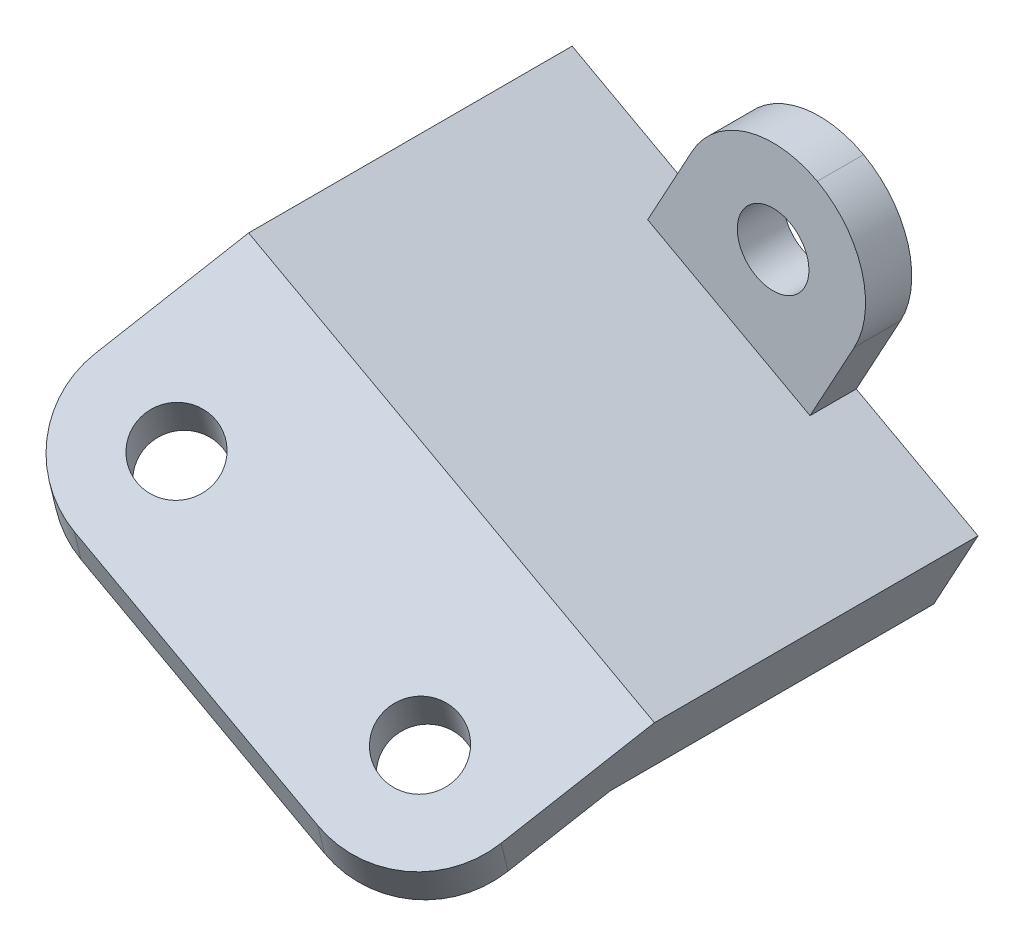
from build123d import *

# Parameters (mm, degrees)
BOSS_EXTRUDE1_DEPTH             = 2
FILLET1_R                       = 4
CUT_EXTRUDE1_REACH              = 137.809
SKETCH2_R                       = 1.55
BOSS_EXTRUDE2_DEPTH             = 12
BOSS_EXTRUDE2_DIRECTION_2_REACH = 137.809
BOSS_EXTRUDE3_DEPTH             = 20
FILLET2_R                       = 4
CUT_EXTRUDE2_REACH              = 70.911
SKETCH5_R                       = 1.55


with BuildPart() as part:
    # Sketch1 → Boss-Extrude1 (new body)
    with BuildSketch(Plane.XY):
        Polygon((70, 114.805547545), (60.427350908, 97.245240333), (53.403228024, 101.07429997), (62.975877115, 118.634607181), align=None)
    extrude(amount=BOSS_EXTRUDE1_DEPTH)

    # Fillet1
    fillet1_edges = [part.edges().sort_by_distance(p)[0] for p in [
        (60.427350908, 97.245240333, 1),
        (53.403228024, 101.07429997, 1),
        (70, 114.805547545, 1),
        (62.975877115, 118.634607181, 1),
    ]]
    fillet(fillet1_edges, radius=FILLET1_R - 0.0001)  # a hair under: the kernel refuses the full size

    # Sketch2 → Cut-Extrude1 (cut, up to next)
    with BuildSketch(Plane.XY.offset(2), mode=Mode.PRIVATE) as cut_extrude1_sk1:
        with Locations((64.573408739, 113.208015921)):
            Circle(SKETCH2_R)
    cut_extrude1_tool1 = extrude(cut_extrude1_sk1.sketch, amount=-CUT_EXTRUDE1_REACH, mode=Mode.PRIVATE) & part.part
    # Sketch2 → Cut-Extrude1 (cut, up to next)
    with BuildSketch(Plane.XY.offset(2), mode=Mode.PRIVATE) as cut_extrude1_sk2:
        with Locations((58.829819284, 102.671831594)):
            Circle(SKETCH2_R)
    cut_extrude1_tool2 = extrude(cut_extrude1_sk2.sketch, amount=-CUT_EXTRUDE1_REACH, mode=Mode.PRIVATE) & part.part
    add(cut_extrude1_tool1.solids().sort_by_distance((64.573409, 113.208016, 2))[0], mode=Mode.SUBTRACT)
    add(cut_extrude1_tool2.solids().sort_by_distance((58.829819, 102.671832, 2))[0], mode=Mode.SUBTRACT)

    # Sketch3 → Boss-Extrude2 (add)
    with BuildSketch(Plane.XY.offset(2)):
        Polygon((66.170940363, 107.78142466), (59.146817479, 111.610484297), (53.878725315, 114.482279024), (51.964195497, 110.970217582), (57.23228766, 108.098422855), (64.256410545, 104.269363218), (69.524502708, 101.39756849), (71.439032527, 104.909629933), align=None)
    extrude(amount=BOSS_EXTRUDE2_DEPTH)

    # Boss-Extrude2 direction 2: up to this face of the body (flat: up to its plane)
    boss_extrude2_direction_2_end = Plane(part.part.faces().sort_by_distance((61.701614012, 107.939923757, 0))[0])
    # Sketch3 → Boss-Extrude2 direction 2 (add, up to the picked face)
    with BuildSketch(Plane.XY.offset(2), mode=Mode.PRIVATE) as boss_extrude2_direction_2_sk1:
        Polygon((66.170940363, 107.78142466), (59.146817479, 111.610484297), (53.878725315, 114.482279024), (51.964195497, 110.970217582), (57.23228766, 108.098422855), (64.256410545, 104.269363218), (69.524502708, 101.39756849), (71.439032527, 104.909629933), align=None)
    boss_extrude2_direction_2_tool1 = split(extrude(boss_extrude2_direction_2_sk1.sketch, amount=-BOSS_EXTRUDE2_DIRECTION_2_REACH, mode=Mode.PRIVATE), bisect_by=boss_extrude2_direction_2_end, keep=Keep.BOTH, mode=Mode.PRIVATE)
    add(boss_extrude2_direction_2_tool1.solids().sort_by(Axis((61.701614, 107.939924, 2), (0, 0, -1)))[0])

    # Sketch4 → Boss-Extrude3 (add)
    with BuildSketch(Plane(origin=(-6.575093345, 3.584280194, 0), x_dir=(0, 0, 1), z_dir=(-0.8780153605811593, 0.4786324545865408, 0))):
        Polygon((22.660254038, 121.305306045), (20.92820323, 118.305306045), (14, 122.305306045), (14, 126.305306045), align=None)
    extrude(amount=-BOSS_EXTRUDE3_DEPTH)

    # Fillet2
    fillet2_edges = [part.edges().sort_by_distance(p)[0] for p in [
        (50.76761436, 108.775179181, 21.794228634),
        (68.327921572, 99.202530089, 21.794228634),
    ]]
    fillet(fillet2_edges, radius=FILLET2_R)

    # Sketch5 → Cut-Extrude2 (cut, up to next)
    with BuildSketch(Plane(origin=(48.241919048, 88.496184373, 58.191801834), x_dir=(0.9100457296544759, -0.34633972242186517, -0.22774012955647066), z_dir=(0.41450786474764584, 0.7603836071762374, 0.5000000000000009)), mode=Mode.PRIVATE) as cut_extrude2_sk1:
        with Locations(Location((8.475365681, 44.360860805, 0), (0, 0, 270))):
            Circle(SKETCH5_R)
    cut_extrude2_tool1 = extrude(cut_extrude2_sk1.sketch, amount=-CUT_EXTRUDE2_REACH, mode=Mode.PRIVATE) & part.part
    # Sketch5 → Cut-Extrude2 (cut, up to next)
    with BuildSketch(Plane(origin=(48.241919048, 88.496184373, 58.191801834), x_dir=(0.9100457296544759, -0.34633972242186517, -0.22774012955647066), z_dir=(0.41450786474764584, 0.7603836071762374, 0.5000000000000009)), mode=Mode.PRIVATE) as cut_extrude2_sk2:
        with Locations(Location((20.053008413, 41.205201002, 0), (0, 0, 270))):
            Circle(SKETCH5_R)
    cut_extrude2_tool2 = extrude(cut_extrude2_sk2.sketch, amount=-CUT_EXTRUDE2_REACH, mode=Mode.PRIVATE) & part.part
    add(cut_extrude2_tool1.solids().sort_by_distance((55.954889, 109.933703, 19.196152))[0], mode=Mode.SUBTRACT)
    add(cut_extrude2_tool2.solids().sort_by_distance((66.491074, 104.190114, 19.196152))[0], mode=Mode.SUBTRACT)


solid = part.part
